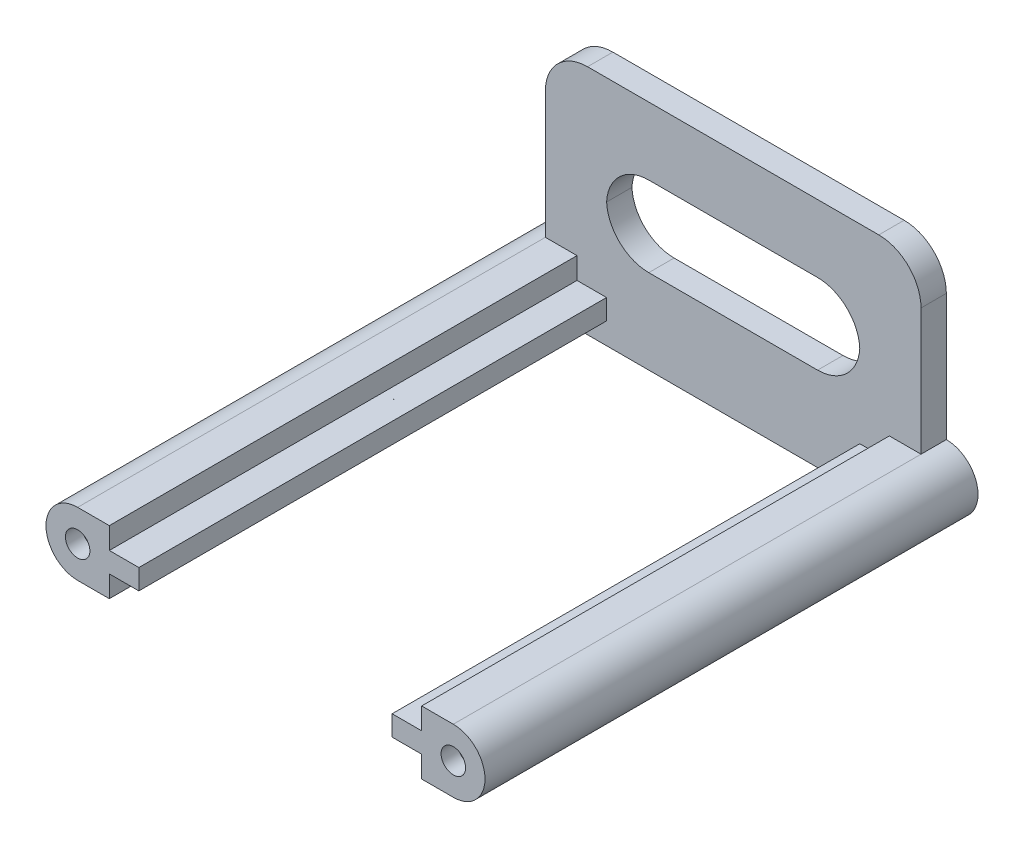
from build123d import *
from build123d.topology import SkipClean

# Parameters (mm, degrees)
SKETCH_1_W           = 3.5
SKETCH_1_H           = 1.2
EXTRUDE_1_DEPTH      = 55.4
EXTRUDE_2_DEPTH      = 2
SKETCH_2_W           = 1
SKETCH_2_H           = 8
EXTRUDE_4_DEPTH      = 2
SKETCH_2_3_W         = 1
SKETCH_2_3_H         = 8
EXTRUDE_6_DEPTH      = 3
FILLET_1_R           = 5
MIRROR_START         = -57.4
MIRROR_2_OUTLINE_R   = 2.75
MIRROR_2_DEPTH       = 2
MIRROR_START_2       = -58.4
MIRROR_2_2_OUTLINE_R = 2.75
MIRROR_2_2_DEPTH     = 1


# Read off the part's stored shape, not the designer's step: 镜向2
with BuildPart() as part:
    # 草图1 → 拉伸1 (new body)
    with BuildSketch(Plane.XY):
        with BuildLine():
            ThreePointArc((19.5, 0.083609377), (22.25, 2.833609377), (25, 0.083609377))
            Line((25, 0.083609377), (26, 0.083609377))
            ThreePointArc((26, 0.083609377), (24.901650429, 2.735259807), (22.25, 3.833609377))
            ThreePointArc((22.25, 3.833609377), (19.598349571, 2.735259807), (18.5, 0.083609377))
            Line((18.5, 0.083609377), (19.5, 0.083609377))
        make_face()
        with BuildLine():
            Line((26, 0.083609377), (25, 0.083609377))
            ThreePointArc((25, 0.083609377), (22.25, -2.666390623), (19.5, 0.083609377))
            Line((19.5, 0.083609377), (18.5, 0.083609377))
            ThreePointArc((18.5, 0.083609377), (19.598349571, -2.568041052), (22.25, -3.666390623))
            ThreePointArc((22.25, -3.666390623), (24.901650429, -2.568041052), (26, 0.083609377))
        make_face()
        with BuildLine():
            ThreePointArc((19.5, 0.083609377), (22.25, 2.833609377), (25, 0.083609377))
            Line((25, 0.083609377), (26, 0.083609377))
            ThreePointArc((26, 0.083609377), (24.901650429, 2.735259807), (22.25, 3.833609377))
            ThreePointArc((22.25, 3.833609377), (19.598349571, 2.735259807), (18.5, 0.083609377))
            Line((18.5, 0.083609377), (19.5, 0.083609377))
        make_face()
        with BuildLine():
            Line((26, 0.083609377), (25, 0.083609377))
            ThreePointArc((25, 0.083609377), (22.25, -2.666390623), (19.5, 0.083609377))
            Line((19.5, 0.083609377), (18.5, 0.083609377))
            ThreePointArc((18.5, 0.083609377), (19.598349571, -2.568041052), (22.25, -3.666390623))
            ThreePointArc((22.25, -3.666390623), (24.901650429, -2.568041052), (26, 0.083609377))
        make_face()
        with BuildLine():
            ThreePointArc((18.5, 0.083609377), (19.598349571, 2.735259807), (22.25, 3.833609377))
            Line((22.25, 3.833609377), (18.5, 3.833609377))
            Line((18.5, 3.833609377), (18.5, 1.283609377))
            Line((18.5, 1.283609377), (18.5, 0.083609377))
        make_face()
        with BuildLine():
            Line((18.5, -3.666390623), (22.25, -3.666390623))
            ThreePointArc((22.25, -3.666390623), (19.598349571, -2.568041052), (18.5, 0.083609377))
            Line((18.5, 0.083609377), (18.5, -1.116390623))
            Line((18.5, -1.116390623), (18.5, -3.666390623))
        make_face()
        with Locations((16.75, -0.516390623)):
            Rectangle(SKETCH_1_W, SKETCH_1_H)
        with Locations((16.75, 0.683609377)):
            Rectangle(SKETCH_1_W, SKETCH_1_H)
    extrude_1 = extrude(amount=-EXTRUDE_1_DEPTH)

    # 草图1<3> → 拉伸2 (add)
    with BuildSketch(Plane.XY):
        with BuildLine():
            ThreePointArc((20.8, 0.083609377), (22.25, 1.533609377), (23.7, 0.083609377))
            Line((23.7, 0.083609377), (25, 0.083609377))
            ThreePointArc((25, 0.083609377), (22.25, 2.833609377), (19.5, 0.083609377))
            Line((19.5, 0.083609377), (20.8, 0.083609377))
        make_face()
        with BuildLine():
            Line((25, 0.083609377), (23.7, 0.083609377))
            ThreePointArc((23.7, 0.083609377), (22.25, -1.366390623), (20.8, 0.083609377))
            Line((20.8, 0.083609377), (19.5, 0.083609377))
            ThreePointArc((19.5, 0.083609377), (22.25, -2.666390623), (25, 0.083609377))
        make_face()
        with BuildLine():
            ThreePointArc((20.8, 0.083609377), (22.25, 1.533609377), (23.7, 0.083609377))
            Line((23.7, 0.083609377), (25, 0.083609377))
            ThreePointArc((25, 0.083609377), (22.25, 2.833609377), (19.5, 0.083609377))
            Line((19.5, 0.083609377), (20.8, 0.083609377))
        make_face()
        with BuildLine():
            Line((25, 0.083609377), (23.7, 0.083609377))
            ThreePointArc((23.7, 0.083609377), (22.25, -1.366390623), (20.8, 0.083609377))
            Line((20.8, 0.083609377), (19.5, 0.083609377))
            ThreePointArc((19.5, 0.083609377), (22.25, -2.666390623), (25, 0.083609377))
        make_face()
    extrude_2 = extrude(amount=-EXTRUDE_2_DEPTH)

    # 草图2 → 拉伸4 (add)
    # profile 1 of 10: a face of its own
    with SkipClean():  # the faces are left unmerged after this step: merging them gives an invalid solid
        with BuildSketch(Plane(origin=(0, 0, -55.4), x_dir=(-1, 0, 0), z_dir=(0, 0, -1))):
            with BuildLine():
                Line((-22.25, 23.833609377), (-22.25, 3.833609377))
                Line((-22.25, 3.833609377), (-19.334524053, 3.833609377))
                ThreePointArc((-19.334524053, 3.833609377), (-20.241930491, 4.388276246), (-21.25, 4.727153282))
                Line((-21.25, 4.727153282), (-21.25, 22.833609377))
                Line((-21.25, 22.833609377), (-1, 22.833609377))
                Line((-1, 22.833609377), (-1, 16.833609377))
                Line((-1, 16.833609377), (-16, 16.833609377))
                Line((-16, 16.833609377), (-16, 5.333609377))
                Line((-16, 5.333609377), (-1, 5.333609377))
                Line((-1, 5.333609377), (0, 5.333609377))
                Line((0, 5.333609377), (0, 6.333609377))
                Line((0, 6.333609377), (-15, 6.333609377))
                Line((-15, 6.333609377), (-15, 15.833609377))
                Line((-15, 15.833609377), (0, 15.833609377))
                Line((0, 15.833609377), (0, 23.833609377))
                Line((0, 23.833609377), (-22.25, 23.833609377))
            make_face()
        # profile 2 of 10: a face of its own
        with BuildSketch(Plane(origin=(0, 0, -55.4), x_dir=(-1, 0, 0), z_dir=(0, 0, -1))):
            with BuildLine():
                ThreePointArc((-17.654077894, -1.116390623), (-17.945210239, -1.924196667), (-18.377016654, -2.666390623))
                Line((-18.377016654, -2.666390623), (-1, -2.666390623))
                Line((-1, -2.666390623), (-1, 5.333609377))
                Line((-1, 5.333609377), (-16, 5.333609377))
                Line((-16, 5.333609377), (-16, 16.833609377))
                Line((-16, 16.833609377), (-1, 16.833609377))
                Line((-1, 16.833609377), (-1, 22.833609377))
                Line((-1, 22.833609377), (-21.25, 22.833609377))
                Line((-21.25, 22.833609377), (-21.25, 4.727153282))
                ThreePointArc((-21.25, 4.727153282), (-20.241930491, 4.388276246), (-19.334524053, 3.833609377))
                Line((-19.334524053, 3.833609377), (-18.5, 3.833609377))
                Line((-18.5, 3.833609377), (-18.5, 2.999085325))
                ThreePointArc((-18.5, 2.999085325), (-17.989798317, 2.184366769), (-17.654077894, 1.283609377))
                Line((-17.654077894, 1.283609377), (-15, 1.283609377))
                Line((-15, 1.283609377), (-15, -1.116390623))
                Line((-15, -1.116390623), (-17.654077894, -1.116390623))
            make_face()
        # profile 3 of 10: a face of its own
        with BuildSketch(Plane(origin=(0, 0, -55.4), x_dir=(-1, 0, 0), z_dir=(0, 0, -1))):
            with Locations((-0.5, 1.333609377)):
                Rectangle(SKETCH_2_W, SKETCH_2_H)
        # profile 4 of 10: a face of its own
        with BuildSketch(Plane(origin=(0, 0, -55.4), x_dir=(-1, 0, 0), z_dir=(0, 0, -1))):
            with BuildLine():
                ThreePointArc((-17.654077894, 1.283609377), (-17.989798317, 2.184366769), (-18.5, 2.999085325))
                Line((-18.5, 2.999085325), (-18.5, 1.283609377))
                Line((-18.5, 1.283609377), (-17.654077894, 1.283609377))
            make_face()
        # profile 5 of 10: a face of its own
        with BuildSketch(Plane(origin=(0, 0, -55.4), x_dir=(-1, 0, 0), z_dir=(0, 0, -1))):
            with BuildLine():
                Line((-18.5, -1.116390623), (-18.5, -2.666390623))
                Line((-18.5, -2.666390623), (-18.377016654, -2.666390623))
                ThreePointArc((-18.377016654, -2.666390623), (-17.945210239, -1.924196667), (-17.654077894, -1.116390623))
                Line((-17.654077894, -1.116390623), (-18.5, -1.116390623))
            make_face()
        # profile 6 of 10: a face of its own
        with BuildSketch(Plane(origin=(0, 0, -55.4), x_dir=(-1, 0, 0), z_dir=(0, 0, -1))):
            with BuildLine():
                ThreePointArc((-17.654077894, 1.283609377), (-17.5, 0.083609377), (-17.654077894, -1.116390623))
                Line((-17.654077894, -1.116390623), (-15, -1.116390623))
                Line((-15, -1.116390623), (-15, 1.283609377))
                Line((-15, 1.283609377), (-17.654077894, 1.283609377))
            make_face()
        # profile 7 of 10: a face of its own
        with BuildSketch(Plane(origin=(0, 0, -55.4), x_dir=(-1, 0, 0), z_dir=(0, 0, -1))):
            with BuildLine():
                Line((-22.25, -3.666390623), (-18.5, -3.666390623))
                Line((-18.5, -3.666390623), (-18.5, -2.666390623))
                Line((-18.5, -2.666390623), (-18.5, -1.116390623))
                Line((-18.5, -1.116390623), (-17.654077894, -1.116390623))
                ThreePointArc((-17.654077894, -1.116390623), (-17.5, 0.083609377), (-17.654077894, 1.283609377))
                Line((-17.654077894, 1.283609377), (-18.5, 1.283609377))
                Line((-18.5, 1.283609377), (-18.5, 2.999085325))
                ThreePointArc((-18.5, 2.999085325), (-18.891242789, 3.442366588), (-19.334524053, 3.833609377))
                Line((-19.334524053, 3.833609377), (-22.25, 3.833609377))
                ThreePointArc((-22.25, 3.833609377), (-21.745411195, 3.799506327), (-21.25, 3.697817451))
                ThreePointArc((-21.25, 3.697817451), (-19.265665903, 2.354347143), (-18.5, 0.083609377))
                ThreePointArc((-18.5, 0.083609377), (-19.598349571, -2.568041052), (-22.25, -3.666390623))
            make_face()
        # profile 8 of 10: a face of its own
        with BuildSketch(Plane(origin=(0, 0, -55.4), x_dir=(-1, 0, 0), z_dir=(0, 0, -1))):
            with BuildLine():
                ThreePointArc((-22.25, 3.833609377), (-26, 0.083609377), (-22.25, -3.666390623))
                ThreePointArc((-22.25, -3.666390623), (-19.598349571, -2.568041052), (-18.5, 0.083609377))
                ThreePointArc((-18.5, 0.083609377), (-19.265665903, 2.354347143), (-21.25, 3.697817451))
                ThreePointArc((-21.25, 3.697817451), (-21.745411195, 3.799506327), (-22.25, 3.833609377))
            make_face()
            with BuildLine():
                ThreePointArc((-22.25, -2.666390623), (-24.952524621, 0.592392901), (-21.25, 2.645347069))
                ThreePointArc((-21.25, 2.645347069), (-19.979262234, 1.634818583), (-19.5, 0.083609377))
                ThreePointArc((-19.5, 0.083609377), (-20.305456352, -1.860934271), (-22.25, -2.666390623))
            make_face(mode=Mode.SUBTRACT)
        # profile 9 of 10: a face of its own
        with BuildSketch(Plane(origin=(0, 0, -55.4), x_dir=(-1, 0, 0), z_dir=(0, 0, -1))):
            Polygon((-18.5, -2.666390623), (-18.5, -3.666390623), (0, -3.666390623), (0, -2.666390623), (-1, -2.666390623), (-18.377016654, -2.666390623), align=None)
        # profile 10 of 10: a face of its own
        with BuildSketch(Plane(origin=(0, 0, -55.4), x_dir=(-1, 0, 0), z_dir=(0, 0, -1))):
            with BuildLine():
                Line((-18.5, 3.833609377), (-19.334524053, 3.833609377))
                ThreePointArc((-19.334524053, 3.833609377), (-18.891242789, 3.442366588), (-18.5, 2.999085325))
                Line((-18.5, 2.999085325), (-18.5, 3.833609377))
            make_face()
        extrude(amount=EXTRUDE_4_DEPTH)

    # 草图2<3> → 拉伸6 (add)
    # profile 1 of 7: a face of its own
    with SkipClean():  # the faces are left unmerged after this step: merging them gives an invalid solid
        with BuildSketch(Plane(origin=(0, 0, -55.4), x_dir=(-1, 0, 0), z_dir=(0, 0, -1))):
            with BuildLine():
                Line((-22.25, 23.833609377), (-22.25, 3.833609377))
                Line((-22.25, 3.833609377), (-19.334524053, 3.833609377))
                ThreePointArc((-19.334524053, 3.833609377), (-20.241930491, 4.388276246), (-21.25, 4.727153282))
                Line((-21.25, 4.727153282), (-21.25, 22.833609377))
                Line((-21.25, 22.833609377), (-1, 22.833609377))
                Line((-1, 22.833609377), (-1, 16.833609377))
                Line((-1, 16.833609377), (-16, 16.833609377))
                Line((-16, 16.833609377), (-16, 5.333609377))
                Line((-16, 5.333609377), (-1, 5.333609377))
                Line((-1, 5.333609377), (0, 5.333609377))
                Line((0, 5.333609377), (0, 6.333609377))
                Line((0, 6.333609377), (-15, 6.333609377))
                Line((-15, 6.333609377), (-15, 15.833609377))
                Line((-15, 15.833609377), (0, 15.833609377))
                Line((0, 15.833609377), (0, 23.833609377))
                Line((0, 23.833609377), (-22.25, 23.833609377))
            make_face()
        # profile 2 of 7: a face of its own
        with BuildSketch(Plane(origin=(0, 0, -55.4), x_dir=(-1, 0, 0), z_dir=(0, 0, -1))):
            with BuildLine():
                Line((-22.25, -3.666390623), (-18.5, -3.666390623))
                Line((-18.5, -3.666390623), (-18.5, -2.666390623))
                Line((-18.5, -2.666390623), (-18.5, -1.116390623))
                Line((-18.5, -1.116390623), (-17.654077894, -1.116390623))
                ThreePointArc((-17.654077894, -1.116390623), (-17.5, 0.083609377), (-17.654077894, 1.283609377))
                Line((-17.654077894, 1.283609377), (-18.5, 1.283609377))
                Line((-18.5, 1.283609377), (-18.5, 2.999085325))
                ThreePointArc((-18.5, 2.999085325), (-18.891242789, 3.442366588), (-19.334524053, 3.833609377))
                Line((-19.334524053, 3.833609377), (-22.25, 3.833609377))
                ThreePointArc((-22.25, 3.833609377), (-21.745411195, 3.799506327), (-21.25, 3.697817451))
                ThreePointArc((-21.25, 3.697817451), (-19.265665903, 2.354347143), (-18.5, 0.083609377))
                ThreePointArc((-18.5, 0.083609377), (-19.598349571, -2.568041052), (-22.25, -3.666390623))
            make_face()
        # profile 3 of 7: a face of its own
        with BuildSketch(Plane(origin=(0, 0, -55.4), x_dir=(-1, 0, 0), z_dir=(0, 0, -1))):
            with BuildLine():
                ThreePointArc((-17.654077894, 1.283609377), (-17.989798317, 2.184366769), (-18.5, 2.999085325))
                Line((-18.5, 2.999085325), (-18.5, 1.283609377))
                Line((-18.5, 1.283609377), (-17.654077894, 1.283609377))
            make_face()
        # profile 4 of 7: a face of its own
        with BuildSketch(Plane(origin=(0, 0, -55.4), x_dir=(-1, 0, 0), z_dir=(0, 0, -1))):
            with BuildLine():
                Line((-18.5, -1.116390623), (-18.5, -2.666390623))
                Line((-18.5, -2.666390623), (-18.377016654, -2.666390623))
                ThreePointArc((-18.377016654, -2.666390623), (-17.945210239, -1.924196667), (-17.654077894, -1.116390623))
                Line((-17.654077894, -1.116390623), (-18.5, -1.116390623))
            make_face()
        # profile 5 of 7: a face of its own
        with BuildSketch(Plane(origin=(0, 0, -55.4), x_dir=(-1, 0, 0), z_dir=(0, 0, -1))):
            Polygon((-18.5, -2.666390623), (-18.5, -3.666390623), (0, -3.666390623), (0, -2.666390623), (-1, -2.666390623), (-18.377016654, -2.666390623), align=None)
        # profile 6 of 7: a face of its own
        with BuildSketch(Plane(origin=(0, 0, -55.4), x_dir=(-1, 0, 0), z_dir=(0, 0, -1))):
            with Locations((-0.5, 1.333609377)):
                Rectangle(SKETCH_2_3_W, SKETCH_2_3_H)
        # profile 7 of 7: a face of its own
        with BuildSketch(Plane(origin=(0, 0, -55.4), x_dir=(-1, 0, 0), z_dir=(0, 0, -1))):
            with BuildLine():
                ThreePointArc((-22.25, 3.833609377), (-26, 0.083609377), (-22.25, -3.666390623))
                ThreePointArc((-22.25, -3.666390623), (-19.598349571, -2.568041052), (-18.5, 0.083609377))
                ThreePointArc((-18.5, 0.083609377), (-19.265665903, 2.354347143), (-21.25, 3.697817451))
                ThreePointArc((-21.25, 3.697817451), (-21.745411195, 3.799506327), (-22.25, 3.833609377))
            make_face()
            with BuildLine():
                ThreePointArc((-22.25, -2.666390623), (-24.952524621, 0.592392901), (-21.25, 2.645347069))
                ThreePointArc((-21.25, 2.645347069), (-19.979262234, 1.634818583), (-19.5, 0.083609377))
                ThreePointArc((-19.5, 0.083609377), (-20.305456352, -1.860934271), (-22.25, -2.666390623))
            make_face(mode=Mode.SUBTRACT)
        extrude(amount=EXTRUDE_6_DEPTH)

    # 圆角1
    # the kernel refuses this fillet: 5 mm, written as the material it adds along each edge
    with BuildSketch(Plane(origin=(21.25, 22.833609377, -44.9), x_dir=(0, -1, 0), z_dir=(0, 0, -1))) as fillet_1_piece_1_section:
        with BuildLine():
            CenterArc((FILLET_1_R, FILLET_1_R), FILLET_1_R, 180, 90)
            Line((0, FILLET_1_R), (0, 0))
            Line((0, 0), (FILLET_1_R, 0))
        make_face()
    fillet_1_piece_1 = extrude(amount=13.5, mode=Mode.PRIVATE)
    fillet_1_piece_1 = split(fillet_1_piece_1, bisect_by=Plane(origin=(20.133160305, 21.716769682, -55.4), z_dir=(0, 0, -1)), keep=Keep.TOP, mode=Mode.PRIVATE)
    add(fillet_1_piece_1)
    with BuildSketch(Plane(origin=(15, 6.333609377, -55.4), x_dir=(-1, 0, 0), z_dir=(0, 0, -1)), Plane(origin=(15, 15.833609377, -55.4), x_dir=(0, -1, 0), z_dir=(0, 0, -1))) as fillet_1_piece_2:
        with BuildLine():
            CenterArc((FILLET_1_R, FILLET_1_R), FILLET_1_R, 180, 90)
            Line((0, FILLET_1_R), (0, 0))
            Line((0, 0), (FILLET_1_R, 0))
        make_face()
    extrude(amount=2)
    with BuildSketch(Plane(origin=(15, 15.833609377, -57.4), x_dir=(0, -1, 0), z_dir=(0, 0, -1)), Plane(origin=(15, 6.333609377, -57.4), x_dir=(-1, 0, 0), z_dir=(0, 0, -1))) as fillet_1_piece_3:
        with BuildLine():
            CenterArc((FILLET_1_R, FILLET_1_R), FILLET_1_R, 180, 90)
            Line((0, FILLET_1_R), (0, 0))
            Line((0, 0), (FILLET_1_R, 0))
        make_face()
    extrude(amount=1)
    # the kernel refuses this fillet: 5 mm, written as the material it takes off along each edge
    with BuildSketch(Plane(origin=(16, 5.333609377, -57.4), x_dir=(0, 1, 0), z_dir=(0, 0, -1)), Plane(origin=(16, 16.833609377, -57.4), x_dir=(-1, 0, 0), z_dir=(0, 0, -1)), Plane(origin=(22.25, 23.833609377, -57.4), x_dir=(-1, 0, 0), z_dir=(0, 0, -1))) as fillet_1_2_piece_1:
        with BuildLine():
            CenterArc((FILLET_1_R, -FILLET_1_R), FILLET_1_R, 90, 90)
            Line((0, -FILLET_1_R), (0, 0))
            Line((0, 0), (FILLET_1_R, 0))
        make_face()
    extrude(amount=13.5, mode=Mode.SUBTRACT)
    with BuildSketch(Plane(origin=(22.25, 23.833609377, -42.9), x_dir=(-1, 0, 0), z_dir=(0, 0, -1))) as fillet_1_2_piece_2:
        with BuildLine():
            CenterArc((FILLET_1_R, -FILLET_1_R), FILLET_1_R, 90, 90)
            Line((0, -FILLET_1_R), (0, 0))
            Line((0, 0), (FILLET_1_R, 0))
        make_face()
    extrude(amount=14.5, mode=Mode.SUBTRACT)

    # 镜向2 outline → 镜向2 (add)
    with BuildSketch(Plane.XY.offset(MIRROR_START)):
        with BuildLine():
            ThreePointArc((-22.25, 3.833609377), (-26, 0.083609377), (-22.25, -3.666390623))
            Line((-22.25, -3.666390623), (0, -3.666390623))
            Line((0, -3.666390623), (0, 6.333609377))
            Line((0, 6.333609377), (-10, 6.333609377))
            ThreePointArc((-10, 6.333609377), (-13.446012188, 7.710765191), (-14.993746089, 11.083609377))
            ThreePointArc((-14.993746089, 11.083609377), (-13.446012188, 14.456453564), (-10, 15.833609377))
            Line((-10, 15.833609377), (0, 15.833609377))
            Line((0, 15.833609377), (0, 23.833609377))
            Line((0, 23.833609377), (-17.25, 23.833609377))
            ThreePointArc((-17.25, 23.833609377), (-20.785533906, 22.369143283), (-22.25, 18.833609377))
            Line((-22.25, 18.833609377), (-22.25, 3.833609377))
        make_face()
        with Locations((-22.25, 0.083609377)):
            Circle(MIRROR_2_OUTLINE_R, mode=Mode.SUBTRACT)
    extrude(amount=MIRROR_2_DEPTH)

    # Mirror 2 2 outline → Mirror 2 2 (add)
    with BuildSketch(Plane.XY.offset(MIRROR_START_2)):
        with BuildLine():
            ThreePointArc((-22.25, 3.833609377), (-26, 0.083609377), (-22.25, -3.666390623))
            Line((-22.25, -3.666390623), (0, -3.666390623))
            Line((0, -3.666390623), (0, 6.333609377))
            Line((0, 6.333609377), (-10, 6.333609377))
            ThreePointArc((-10, 6.333609377), (-13.446012188, 7.710765191), (-14.993746089, 11.083609377))
            ThreePointArc((-14.993746089, 11.083609377), (-13.446012188, 14.456453564), (-10, 15.833609377))
            Line((-10, 15.833609377), (0, 15.833609377))
            Line((0, 15.833609377), (0, 23.833609377))
            Line((0, 23.833609377), (-17.25, 23.833609377))
            ThreePointArc((-17.25, 23.833609377), (-20.785533906, 22.369143283), (-22.25, 18.833609377))
            Line((-22.25, 18.833609377), (-22.25, 3.833609377))
        make_face()
        with Locations((-22.25, 0.083609377)):
            Circle(MIRROR_2_2_OUTLINE_R, mode=Mode.SUBTRACT)
        with BuildLine():
            Line((-1, -2.666390623), (-18.377016654, -2.666390623))
            ThreePointArc((-18.377016654, -2.666390623), (-17.822516003, 1.804041142), (-21.25, 4.727153282))
            Line((-21.25, 4.727153282), (-21.25, 17.833609377))
            ThreePointArc((-21.25, 17.833609377), (-19.785533906, 21.369143283), (-16.25, 22.833609377))
            Line((-16.25, 22.833609377), (-1, 22.833609377))
            Line((-1, 22.833609377), (-1, 16.833609377))
            Line((-1, 16.833609377), (-11, 16.833609377))
            ThreePointArc((-11, 16.833609377), (-14.535533906, 15.369143283), (-16, 11.833609377))
            Line((-16, 11.833609377), (-16, 10.333609377))
            ThreePointArc((-16, 10.333609377), (-14.535533906, 6.798075471), (-11, 5.333609377))
            Line((-11, 5.333609377), (-1, 5.333609377))
            Line((-1, 5.333609377), (-1, -2.666390623))
        make_face(mode=Mode.SUBTRACT)
    extrude(amount=MIRROR_2_2_DEPTH)

    # 镜向3: 拉伸1, 拉伸2 across plane
    add(extrude_1.mirror(Plane(origin=(0, 0, 0), x_dir=(0, 0, 1), z_dir=(1, 0, 0))))
    add(extrude_2.mirror(Plane(origin=(0, 0, 0), x_dir=(0, 0, 1), z_dir=(1, 0, 0))))


solid = part.part
